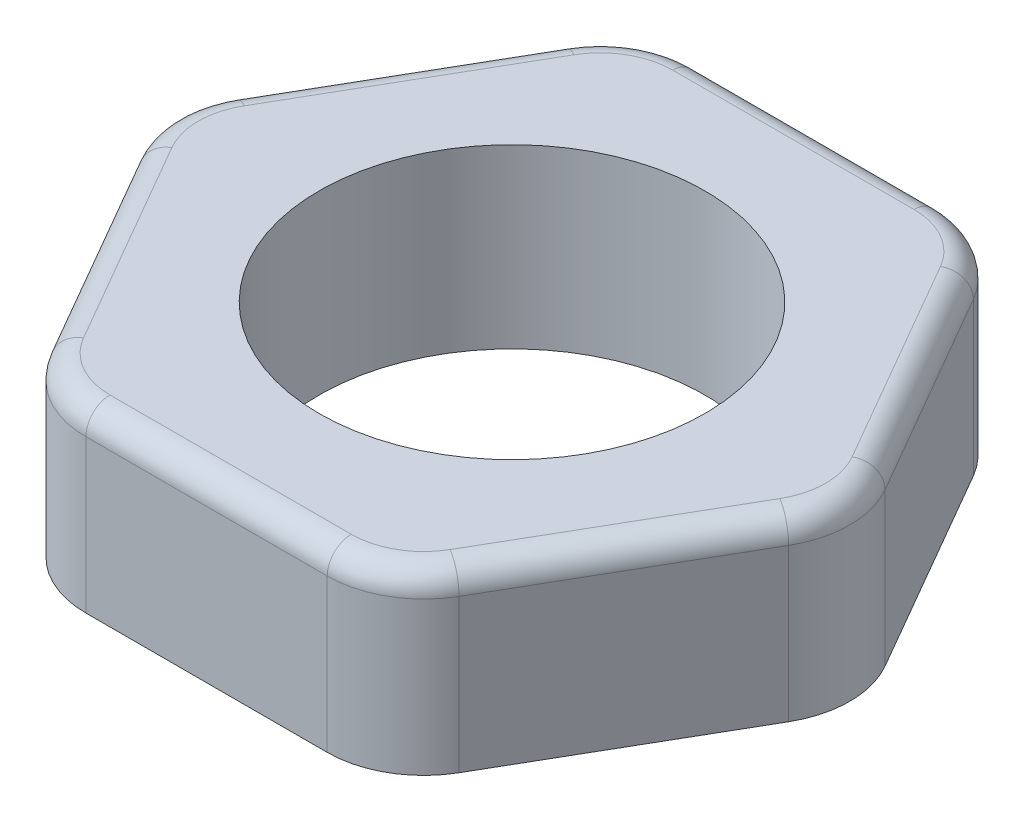
from build123d import *

# Parameters (mm, degrees)
BOSS_EXTRUDE1_DEPTH = 5.5
FILLET1_R           = 0.75
FILLET2_R           = 3
SKETCH2_R           = 6
CUT_EXTRUDE1_DEPTH  = 16.19429676984497


with BuildPart() as part:
    # Sketch1 → Boss-Extrude1 (new body)
    with BuildSketch(Plane(origin=(0, 0, 0), x_dir=(1, 0, 0), z_dir=(0, 1, 0))):
        Polygon((10.969655114602853, 0), (5.484827557301405, 9.499999999999982), (-5.48482755730147, 9.499999999999945), (-10.969655114602851, -7.66e-14), (-5.484827557301339, -9.50000000000002), (5.4848275573015375, -9.499999999999904), align=None)
    extrude(amount=BOSS_EXTRUDE1_DEPTH)

    # Fillet1
    fillet1_edges = [part.edges().sort_by_distance(p)[0] for p in [
        (-3.286e-14, 5.5, -9.499999999999964),
        (-8.227241335952161, 5.5, -4.749999999999934),
        (-8.227241335952096, 5.5, 4.750000000000048),
        (9.859e-14, 5.5, 9.499999999999961),
        (8.227241335952195, 5.5, 4.749999999999952),
        (8.22724133595213, 5.5, -4.749999999999991),
    ]]
    fillet(fillet1_edges, radius=FILLET1_R)

    # Fillet2
    # the kernel refuses this fillet: 3 mm, written as the material it takes off along each edge
    with BuildSketch(Plane(origin=(3.752776749732533, 5.5, -6.499999999999977), x_dir=(0.8660254037844382, 0, -0.500000000000001), z_dir=(0.500000000000001, 0, 0.8660254037844382))) as fillet2_piece_1:
        with BuildLine():
            CenterArc((2.25, -0.75), 0.75, 0, 90)
            Line((3, -0.75), (3, 0))
            Line((3, 0), (2.25, 0))
        make_face()
    revolve(axis=Axis((3.752776749732533, 5.5, -6.499999999999977), (0, 1, 0)), revolution_arc=60.000000000000135, mode=Mode.SUBTRACT)
    with BuildSketch(Plane(origin=(7.505553499465103, 5.5, 1.221e-14), x_dir=(0.8660254037844416, 0, 0.49999999999999495), z_dir=(-0.49999999999999495, 0, 0.8660254037844416))) as fillet2_piece_2:
        with BuildLine():
            CenterArc((2.25, -0.75), 0.75, 0, 90)
            Line((3, -0.75), (3, 0))
            Line((3, 0), (2.25, 0))
        make_face()
    revolve(axis=Axis((7.505553499465103, 5.5, 1.221e-14), (0, 1, 0)), revolution_arc=59.99999999999973, mode=Mode.SUBTRACT)
    with BuildSketch(Plane(origin=(-3.752776749732577, 5.5, -6.49999999999995), x_dir=(-3.4e-15, 0, -1), z_dir=(1, 0, -3.4e-15))) as fillet2_piece_3:
        with BuildLine():
            CenterArc((2.25, -0.75), 0.75, 0, 90)
            Line((3, -0.75), (3, 0))
            Line((3, 0), (2.25, 0))
        make_face()
    revolve(axis=Axis((-3.752776749732577, 5.5, -6.49999999999995), (0, 1, 0)), revolution_arc=60.00000000000015, mode=Mode.SUBTRACT)
    with BuildSketch(Plane(origin=(3.7527767497326376, 5.5, 6.499999999999923), x_dir=(1.053e-14, 0, 1), z_dir=(-1, 0, 1.053e-14))) as fillet2_piece_4:
        with BuildLine():
            CenterArc((2.25, -0.75), 0.75, 0, 90)
            Line((3, -0.75), (3, 0))
            Line((3, 0), (2.25, 0))
        make_face()
    revolve(axis=Axis((3.7527767497326376, 5.5, 6.499999999999923), (0, 1, 0)), revolution_arc=59.99999999999973, mode=Mode.SUBTRACT)
    with BuildSketch(Plane(origin=(-7.505553499465096, 5.5, 5.373e-14), x_dir=(-0.8660254037844417, 0, -0.49999999999999484), z_dir=(0.49999999999999484, 0, -0.8660254037844417))) as fillet2_piece_5:
        with BuildLine():
            CenterArc((2.25, -0.75), 0.75, 0, 90)
            Line((3, -0.75), (3, 0))
            Line((3, 0), (2.25, 0))
        make_face()
    revolve(axis=Axis((-7.505553499465096, 5.5, 5.373e-14), (0, 1, 0)), revolution_arc=60.00000000000011, mode=Mode.SUBTRACT)
    with BuildSketch(Plane(origin=(-3.752776749732488, 5.5, 6.500000000000002), x_dir=(-0.8660254037844347, 0, 0.5000000000000068), z_dir=(-0.5000000000000068, 0, -0.8660254037844347))) as fillet2_piece_6:
        with BuildLine():
            CenterArc((2.25, -0.75), 0.75, 0, 90)
            Line((3, -0.75), (3, 0))
            Line((3, 0), (2.25, 0))
        make_face()
    revolve(axis=Axis((-3.752776749732488, 5.5, 6.500000000000002), (0, 1, 0)), revolution_arc=60.00000000000016, mode=Mode.SUBTRACT)
    with BuildSketch(Plane(origin=(-5.484827557301339, -4.330127018922208, 9.50000000000002), x_dir=(1, 0, -1.026e-14), z_dir=(0, 1, 0))) as fillet2_piece_7:
        with BuildLine():
            CenterArc((FILLET2_R * 0.57735026919, FILLET2_R), FILLET2_R, 209.99999999999983, 60.00000000000017)
            Line((-FILLET2_R * 0.288675134595, FILLET2_R * 0.5), (0, 0))
            Line((0, 0), (FILLET2_R * 0.57735026919, 0))
        make_face()
    extrude(amount=9.830127018922209, mode=Mode.SUBTRACT)
    with BuildSketch(Plane(origin=(-10.969655114602851, -4.3301270189222, 7.638e-14), x_dir=(0.4999999999999946, 0, -0.8660254037844417), z_dir=(0, 1, 0))) as fillet2_piece_8:
        with BuildLine():
            CenterArc((FILLET2_R * 0.57735026919, -FILLET2_R), FILLET2_R, 89.99999999999999, 60.00000000000007)
            Line((-FILLET2_R * 0.288675134595, -FILLET2_R * 0.5), (0, 0))
            Line((0, 0), (FILLET2_R * 0.57735026919, 3e-17))
        make_face()
    extrude(amount=9.8301270189222, mode=Mode.SUBTRACT)
    with BuildSketch(Plane(origin=(-5.484827557301471, -4.330127018922209, -9.499999999999945), x_dir=(1, 0, -3.08e-15), z_dir=(0, 1, 0))) as fillet2_piece_9:
        with BuildLine():
            CenterArc((FILLET2_R * 0.57735026919, -FILLET2_R), FILLET2_R, 90.00000000000003, 60.00000000000017)
            Line((-FILLET2_R * 0.288675134595, -FILLET2_R * 0.5), (0, 0))
            Line((0, 0), (FILLET2_R * 0.57735026919, 0))
        make_face()
    extrude(amount=9.830127018922209, mode=Mode.SUBTRACT)
    with BuildSketch(Plane(origin=(5.484827557301404, -4.330127018922204, -9.499999999999982), x_dir=(0.5000000000000011, 0, 0.866025403784438), z_dir=(0, 1, 0))) as fillet2_piece_10:
        with BuildLine():
            CenterArc((FILLET2_R * 0.57735026919, -FILLET2_R), FILLET2_R, 90, 60.00000000000014)
            Line((-FILLET2_R * 0.288675134595, -FILLET2_R * 0.5), (0, 0))
            Line((0, 0), (FILLET2_R * 0.57735026919, 1.1e-16))
        make_face()
    extrude(amount=9.830127018922205, mode=Mode.SUBTRACT)
    with BuildSketch(Plane(origin=(10.969655114602853, -4.330127018922171, 0), x_dir=(-0.500000000000001, 0, -0.8660254037844382), z_dir=(0, 1, 0))) as fillet2_piece_11:
        with BuildLine():
            CenterArc((FILLET2_R * 0.57735026919, FILLET2_R), FILLET2_R, 210.00000000000028, 59.999999999999716)
            Line((-FILLET2_R * 0.288675134595, FILLET2_R * 0.5), (0, 0))
            Line((0, 0), (FILLET2_R * 0.57735026919, 6e-17))
        make_face()
    extrude(amount=9.83012701892217, mode=Mode.SUBTRACT)
    with BuildSketch(Plane(origin=(5.4848275573015375, -4.330127018922169, 9.499999999999904), x_dir=(0.499999999999995, 0, -0.8660254037844415), z_dir=(0, 1, 0))) as fillet2_piece_12:
        with BuildLine():
            CenterArc((FILLET2_R * 0.57735026919, FILLET2_R), FILLET2_R, 210.00000000000028, 59.999999999999716)
            Line((-FILLET2_R * 0.288675134595, FILLET2_R * 0.5), (0, 0))
            Line((0, 0), (FILLET2_R * 0.57735026919, 6e-17))
        make_face()
    extrude(amount=9.83012701892217, mode=Mode.SUBTRACT)

    # Sketch2 → Cut-Extrude1 (cut, through all)
    with BuildSketch(Plane(origin=(0, 5.5, 0), x_dir=(1, 0, 0), z_dir=(0, 1, 0))):
        with Locations(Location((0, 0, 0), (0, 0, 270))):
            Circle(SKETCH2_R)
    extrude(amount=-CUT_EXTRUDE1_DEPTH, mode=Mode.SUBTRACT)


solid = part.part
